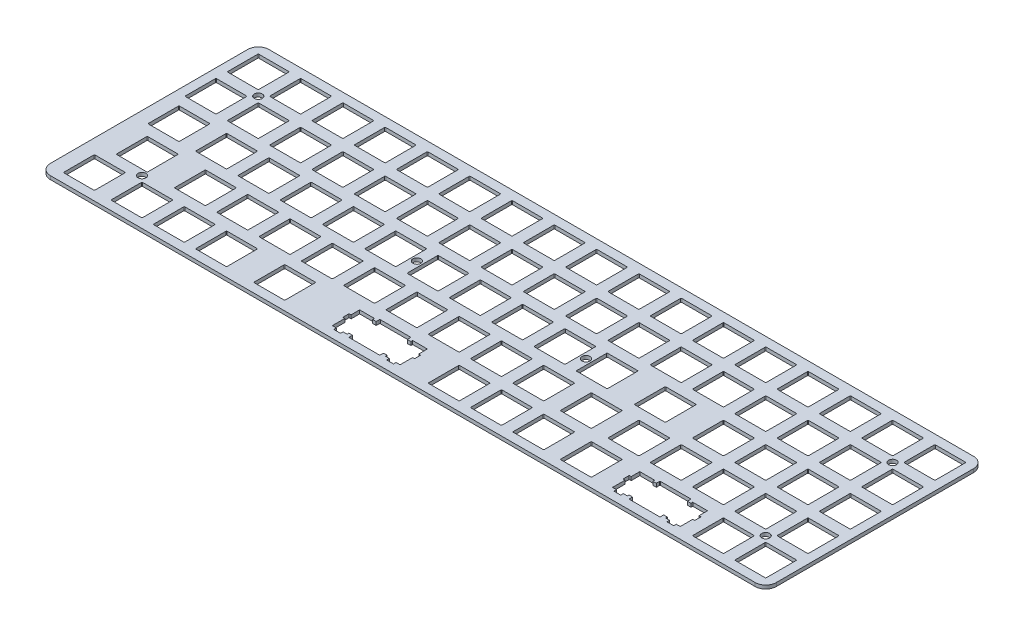
from build123d import *

# Parameters (mm, degrees)
SKETCH2_R           = 1.784477
SKETCH2_W           = 13.9954
SKETCH2_H           = 13.9954
BOSS_EXTRUDE1_DEPTH = 0.79375
CUT_EXTRUDE1_DEPTH  = 171.765125154
FILLET1_R           = 0.3048


with BuildPart() as part:
    # Sketch2 → Boss-Extrude1 (new, symmetric)
    with BuildSketch(Plane(origin=(0, 0, 0), x_dir=(1, 0, 0), z_dir=(0, 1, 0))):
        with BuildLine():
            Line((158.75, -49.2125), (-158.75, -49.2125))
            ThreePointArc((-158.75, -49.2125), (-162.117596045, -47.817596045), (-163.5125, -44.45))
            Line((-163.5125, -44.45), (-163.5125, 44.45))
            ThreePointArc((-163.5125, 44.45), (-162.117596045, 47.817596045), (-158.75, 49.2125))
            Line((-158.75, 49.2125), (158.75, 49.2125))
            ThreePointArc((158.75, 49.2125), (162.117596045, 47.817596045), (163.5125, 44.45))
            Line((163.5125, 44.45), (163.5125, -44.45))
            ThreePointArc((163.5125, -44.45), (162.117596045, -47.817596045), (158.75, -49.2125))
        make_face()
        with Locations((-142.875, 28.575)):
            Circle(SKETCH2_R, mode=Mode.SUBTRACT)
        with Locations((-138.1125, -28.575)):
            Circle(SKETCH2_R, mode=Mode.SUBTRACT)
        with Locations((142.875, 28.575)):
            Circle(SKETCH2_R, mode=Mode.SUBTRACT)
        with Locations((142.875, -28.575)):
            Circle(SKETCH2_R, mode=Mode.SUBTRACT)
        with Locations((-42.8625, 0)):
            Circle(SKETCH2_R, mode=Mode.SUBTRACT)
        with Locations((33.3375, 0)):
            Circle(SKETCH2_R, mode=Mode.SUBTRACT)
        with BuildLine():
            Line((-145.7071, 45.0977), (-159.0929, 45.0977))
            ThreePointArc((-159.0929, 45.0977), (-159.308426147, 45.008426147), (-159.3977, 44.7929))
            Line((-159.3977, 44.7929), (-159.3977, 31.4071))
            ThreePointArc((-159.3977, 31.4071), (-159.308426147, 31.191573853), (-159.0929, 31.1023))
            Line((-159.0929, 31.1023), (-145.7071, 31.1023))
            ThreePointArc((-145.7071, 31.1023), (-145.491573853, 31.191573853), (-145.4023, 31.4071))
            Line((-145.4023, 31.4071), (-145.4023, 44.7929))
            ThreePointArc((-145.4023, 44.7929), (-145.491573853, 45.008426147), (-145.7071, 45.0977))
        make_face(mode=Mode.SUBTRACT)
        with BuildLine():
            Line((-126.6571, 45.0977), (-140.0429, 45.0977))
            ThreePointArc((-140.0429, 45.0977), (-140.258426147, 45.008426147), (-140.3477, 44.7929))
            Line((-140.3477, 44.7929), (-140.3477, 31.4071))
            ThreePointArc((-140.3477, 31.4071), (-140.258426147, 31.191573853), (-140.0429, 31.1023))
            Line((-140.0429, 31.1023), (-126.6571, 31.1023))
            ThreePointArc((-126.6571, 31.1023), (-126.441573853, 31.191573853), (-126.3523, 31.4071))
            Line((-126.3523, 31.4071), (-126.3523, 44.7929))
            ThreePointArc((-126.3523, 44.7929), (-126.441573853, 45.008426147), (-126.6571, 45.0977))
        make_face(mode=Mode.SUBTRACT)
        with BuildLine():
            Line((-107.6071, 45.0977), (-120.9929, 45.0977))
            ThreePointArc((-120.9929, 45.0977), (-121.208426147, 45.008426147), (-121.2977, 44.7929))
            Line((-121.2977, 44.7929), (-121.2977, 31.4071))
            ThreePointArc((-121.2977, 31.4071), (-121.208426147, 31.191573853), (-120.9929, 31.1023))
            Line((-120.9929, 31.1023), (-107.6071, 31.1023))
            ThreePointArc((-107.6071, 31.1023), (-107.391573853, 31.191573853), (-107.3023, 31.4071))
            Line((-107.3023, 31.4071), (-107.3023, 44.7929))
            ThreePointArc((-107.3023, 44.7929), (-107.391573853, 45.008426147), (-107.6071, 45.0977))
        make_face(mode=Mode.SUBTRACT)
        with BuildLine():
            Line((-88.5571, 45.0977), (-101.9429, 45.0977))
            ThreePointArc((-101.9429, 45.0977), (-102.158426147, 45.008426147), (-102.2477, 44.7929))
            Line((-102.2477, 44.7929), (-102.2477, 31.4071))
            ThreePointArc((-102.2477, 31.4071), (-102.158426147, 31.191573853), (-101.9429, 31.1023))
            Line((-101.9429, 31.1023), (-88.5571, 31.1023))
            ThreePointArc((-88.5571, 31.1023), (-88.341573853, 31.191573853), (-88.2523, 31.4071))
            Line((-88.2523, 31.4071), (-88.2523, 44.7929))
            ThreePointArc((-88.2523, 44.7929), (-88.341573853, 45.008426147), (-88.5571, 45.0977))
        make_face(mode=Mode.SUBTRACT)
        with BuildLine():
            Line((-69.5071, 45.0977), (-82.8929, 45.0977))
            ThreePointArc((-82.8929, 45.0977), (-83.108426147, 45.008426147), (-83.1977, 44.7929))
            Line((-83.1977, 44.7929), (-83.1977, 31.4071))
            ThreePointArc((-83.1977, 31.4071), (-83.108426147, 31.191573853), (-82.8929, 31.1023))
            Line((-82.8929, 31.1023), (-69.5071, 31.1023))
            ThreePointArc((-69.5071, 31.1023), (-69.291573853, 31.191573853), (-69.2023, 31.4071))
            Line((-69.2023, 31.4071), (-69.2023, 44.7929))
            ThreePointArc((-69.2023, 44.7929), (-69.291573853, 45.008426147), (-69.5071, 45.0977))
        make_face(mode=Mode.SUBTRACT)
        with BuildLine():
            Line((-50.4571, 45.0977), (-63.8429, 45.0977))
            ThreePointArc((-63.8429, 45.0977), (-64.058426147, 45.008426147), (-64.1477, 44.7929))
            Line((-64.1477, 44.7929), (-64.1477, 31.4071))
            ThreePointArc((-64.1477, 31.4071), (-64.058426147, 31.191573853), (-63.8429, 31.1023))
            Line((-63.8429, 31.1023), (-50.4571, 31.1023))
            ThreePointArc((-50.4571, 31.1023), (-50.241573853, 31.191573853), (-50.1523, 31.4071))
            Line((-50.1523, 31.4071), (-50.1523, 44.7929))
            ThreePointArc((-50.1523, 44.7929), (-50.241573853, 45.008426147), (-50.4571, 45.0977))
        make_face(mode=Mode.SUBTRACT)
        with BuildLine():
            Line((-31.4071, 45.0977), (-44.7929, 45.0977))
            ThreePointArc((-44.7929, 45.0977), (-45.008426147, 45.008426147), (-45.0977, 44.7929))
            Line((-45.0977, 44.7929), (-45.0977, 31.4071))
            ThreePointArc((-45.0977, 31.4071), (-45.008426147, 31.191573853), (-44.7929, 31.1023))
            Line((-44.7929, 31.1023), (-31.4071, 31.1023))
            ThreePointArc((-31.4071, 31.1023), (-31.191573853, 31.191573853), (-31.1023, 31.4071))
            Line((-31.1023, 31.4071), (-31.1023, 44.7929))
            ThreePointArc((-31.1023, 44.7929), (-31.191573853, 45.008426147), (-31.4071, 45.0977))
        make_face(mode=Mode.SUBTRACT)
        with BuildLine():
            Line((-12.3571, 45.0977), (-25.7429, 45.0977))
            ThreePointArc((-25.7429, 45.0977), (-25.958426147, 45.008426147), (-26.0477, 44.7929))
            Line((-26.0477, 44.7929), (-26.0477, 31.4071))
            ThreePointArc((-26.0477, 31.4071), (-25.958426147, 31.191573853), (-25.7429, 31.1023))
            Line((-25.7429, 31.1023), (-12.3571, 31.1023))
            ThreePointArc((-12.3571, 31.1023), (-12.141573853, 31.191573853), (-12.0523, 31.4071))
            Line((-12.0523, 31.4071), (-12.0523, 44.7929))
            ThreePointArc((-12.0523, 44.7929), (-12.141573853, 45.008426147), (-12.3571, 45.0977))
        make_face(mode=Mode.SUBTRACT)
        with BuildLine():
            Line((6.6929, 45.0977), (-6.6929, 45.0977))
            ThreePointArc((-6.6929, 45.0977), (-6.908426147, 45.008426147), (-6.9977, 44.7929))
            Line((-6.9977, 44.7929), (-6.9977, 31.4071))
            ThreePointArc((-6.9977, 31.4071), (-6.908426147, 31.191573853), (-6.6929, 31.1023))
            Line((-6.6929, 31.1023), (6.6929, 31.1023))
            ThreePointArc((6.6929, 31.1023), (6.908426147, 31.191573853), (6.9977, 31.4071))
            Line((6.9977, 31.4071), (6.9977, 44.7929))
            ThreePointArc((6.9977, 44.7929), (6.908426147, 45.008426147), (6.6929, 45.0977))
        make_face(mode=Mode.SUBTRACT)
        with BuildLine():
            Line((25.7429, 45.0977), (12.3571, 45.0977))
            ThreePointArc((12.3571, 45.0977), (12.141573853, 45.008426147), (12.0523, 44.7929))
            Line((12.0523, 44.7929), (12.0523, 31.4071))
            ThreePointArc((12.0523, 31.4071), (12.141573853, 31.191573853), (12.3571, 31.1023))
            Line((12.3571, 31.1023), (25.7429, 31.1023))
            ThreePointArc((25.7429, 31.1023), (25.958426147, 31.191573853), (26.0477, 31.4071))
            Line((26.0477, 31.4071), (26.0477, 44.7929))
            ThreePointArc((26.0477, 44.7929), (25.958426147, 45.008426147), (25.7429, 45.0977))
        make_face(mode=Mode.SUBTRACT)
        with BuildLine():
            Line((44.7929, 45.0977), (31.4071, 45.0977))
            ThreePointArc((31.4071, 45.0977), (31.191573853, 45.008426147), (31.1023, 44.7929))
            Line((31.1023, 44.7929), (31.1023, 31.4071))
            ThreePointArc((31.1023, 31.4071), (31.191573853, 31.191573853), (31.4071, 31.1023))
            Line((31.4071, 31.1023), (44.7929, 31.1023))
            ThreePointArc((44.7929, 31.1023), (45.008426147, 31.191573853), (45.0977, 31.4071))
            Line((45.0977, 31.4071), (45.0977, 44.7929))
            ThreePointArc((45.0977, 44.7929), (45.008426147, 45.008426147), (44.7929, 45.0977))
        make_face(mode=Mode.SUBTRACT)
        with BuildLine():
            Line((63.8429, 45.0977), (50.4571, 45.0977))
            ThreePointArc((50.4571, 45.0977), (50.241573853, 45.008426147), (50.1523, 44.7929))
            Line((50.1523, 44.7929), (50.1523, 31.4071))
            ThreePointArc((50.1523, 31.4071), (50.241573853, 31.191573853), (50.4571, 31.1023))
            Line((50.4571, 31.1023), (63.8429, 31.1023))
            ThreePointArc((63.8429, 31.1023), (64.058426147, 31.191573853), (64.1477, 31.4071))
            Line((64.1477, 31.4071), (64.1477, 44.7929))
            ThreePointArc((64.1477, 44.7929), (64.058426147, 45.008426147), (63.8429, 45.0977))
        make_face(mode=Mode.SUBTRACT)
        with BuildLine():
            Line((82.8929, 45.0977), (69.5071, 45.0977))
            ThreePointArc((69.5071, 45.0977), (69.291573853, 45.008426147), (69.2023, 44.7929))
            Line((69.2023, 44.7929), (69.2023, 31.4071))
            ThreePointArc((69.2023, 31.4071), (69.291573853, 31.191573853), (69.5071, 31.1023))
            Line((69.5071, 31.1023), (82.8929, 31.1023))
            ThreePointArc((82.8929, 31.1023), (83.108426147, 31.191573853), (83.1977, 31.4071))
            Line((83.1977, 31.4071), (83.1977, 44.7929))
            ThreePointArc((83.1977, 44.7929), (83.108426147, 45.008426147), (82.8929, 45.0977))
        make_face(mode=Mode.SUBTRACT)
        with BuildLine():
            Line((101.9429, 45.0977), (88.5571, 45.0977))
            ThreePointArc((88.5571, 45.0977), (88.341573853, 45.008426147), (88.2523, 44.7929))
            Line((88.2523, 44.7929), (88.2523, 31.4071))
            ThreePointArc((88.2523, 31.4071), (88.341573853, 31.191573853), (88.5571, 31.1023))
            Line((88.5571, 31.1023), (101.9429, 31.1023))
            ThreePointArc((101.9429, 31.1023), (102.158426147, 31.191573853), (102.2477, 31.4071))
            Line((102.2477, 31.4071), (102.2477, 44.7929))
            ThreePointArc((102.2477, 44.7929), (102.158426147, 45.008426147), (101.9429, 45.0977))
        make_face(mode=Mode.SUBTRACT)
        with BuildLine():
            Line((120.9929, 45.0977), (107.6071, 45.0977))
            ThreePointArc((107.6071, 45.0977), (107.391573853, 45.008426147), (107.3023, 44.7929))
            Line((107.3023, 44.7929), (107.3023, 31.4071))
            ThreePointArc((107.3023, 31.4071), (107.391573853, 31.191573853), (107.6071, 31.1023))
            Line((107.6071, 31.1023), (120.9929, 31.1023))
            ThreePointArc((120.9929, 31.1023), (121.208426147, 31.191573853), (121.2977, 31.4071))
            Line((121.2977, 31.4071), (121.2977, 44.7929))
            ThreePointArc((121.2977, 44.7929), (121.208426147, 45.008426147), (120.9929, 45.0977))
        make_face(mode=Mode.SUBTRACT)
        with BuildLine():
            Line((140.0429, 45.0977), (126.6571, 45.0977))
            ThreePointArc((126.6571, 45.0977), (126.441573853, 45.008426147), (126.3523, 44.7929))
            Line((126.3523, 44.7929), (126.3523, 31.4071))
            ThreePointArc((126.3523, 31.4071), (126.441573853, 31.191573853), (126.6571, 31.1023))
            Line((126.6571, 31.1023), (140.0429, 31.1023))
            ThreePointArc((140.0429, 31.1023), (140.258426147, 31.191573853), (140.3477, 31.4071))
            Line((140.3477, 31.4071), (140.3477, 44.7929))
            ThreePointArc((140.3477, 44.7929), (140.258426147, 45.008426147), (140.0429, 45.0977))
        make_face(mode=Mode.SUBTRACT)
        with BuildLine():
            Line((159.0929, 45.0977), (145.7071, 45.0977))
            ThreePointArc((145.7071, 45.0977), (145.491573853, 45.008426147), (145.4023, 44.7929))
            Line((145.4023, 44.7929), (145.4023, 31.4071))
            ThreePointArc((145.4023, 31.4071), (145.491573853, 31.191573853), (145.7071, 31.1023))
            Line((145.7071, 31.1023), (159.0929, 31.1023))
            ThreePointArc((159.0929, 31.1023), (159.308426147, 31.191573853), (159.3977, 31.4071))
            Line((159.3977, 31.4071), (159.3977, 44.7929))
            ThreePointArc((159.3977, 44.7929), (159.308426147, 45.008426147), (159.0929, 45.0977))
        make_face(mode=Mode.SUBTRACT)
        with BuildLine():
            Line((-126.6571, 26.0477), (-140.0429, 26.0477))
            ThreePointArc((-140.0429, 26.0477), (-140.258426147, 25.958426147), (-140.3477, 25.7429))
            Line((-140.3477, 25.7429), (-140.3477, 12.3571))
            ThreePointArc((-140.3477, 12.3571), (-140.258426147, 12.141573853), (-140.0429, 12.0523))
            Line((-140.0429, 12.0523), (-126.6571, 12.0523))
            ThreePointArc((-126.6571, 12.0523), (-126.441573853, 12.141573853), (-126.3523, 12.3571))
            Line((-126.3523, 12.3571), (-126.3523, 25.7429))
            ThreePointArc((-126.3523, 25.7429), (-126.441573853, 25.958426147), (-126.6571, 26.0477))
        make_face(mode=Mode.SUBTRACT)
        with BuildLine():
            Line((-107.6071, 26.0477), (-120.9929, 26.0477))
            ThreePointArc((-120.9929, 26.0477), (-121.208426147, 25.958426147), (-121.2977, 25.7429))
            Line((-121.2977, 25.7429), (-121.2977, 12.3571))
            ThreePointArc((-121.2977, 12.3571), (-121.208426147, 12.141573853), (-120.9929, 12.0523))
            Line((-120.9929, 12.0523), (-107.6071, 12.0523))
            ThreePointArc((-107.6071, 12.0523), (-107.391573853, 12.141573853), (-107.3023, 12.3571))
            Line((-107.3023, 12.3571), (-107.3023, 25.7429))
            ThreePointArc((-107.3023, 25.7429), (-107.391573853, 25.958426147), (-107.6071, 26.0477))
        make_face(mode=Mode.SUBTRACT)
        with BuildLine():
            Line((-88.5571, 26.0477), (-101.9429, 26.0477))
            ThreePointArc((-101.9429, 26.0477), (-102.158426147, 25.958426147), (-102.2477, 25.7429))
            Line((-102.2477, 25.7429), (-102.2477, 12.3571))
            ThreePointArc((-102.2477, 12.3571), (-102.158426147, 12.141573853), (-101.9429, 12.0523))
            Line((-101.9429, 12.0523), (-88.5571, 12.0523))
            ThreePointArc((-88.5571, 12.0523), (-88.341573853, 12.141573853), (-88.2523, 12.3571))
            Line((-88.2523, 12.3571), (-88.2523, 25.7429))
            ThreePointArc((-88.2523, 25.7429), (-88.341573853, 25.958426147), (-88.5571, 26.0477))
        make_face(mode=Mode.SUBTRACT)
        with BuildLine():
            Line((-69.5071, 26.0477), (-82.8929, 26.0477))
            ThreePointArc((-82.8929, 26.0477), (-83.108426147, 25.958426147), (-83.1977, 25.7429))
            Line((-83.1977, 25.7429), (-83.1977, 12.3571))
            ThreePointArc((-83.1977, 12.3571), (-83.108426147, 12.141573853), (-82.8929, 12.0523))
            Line((-82.8929, 12.0523), (-69.5071, 12.0523))
            ThreePointArc((-69.5071, 12.0523), (-69.291573853, 12.141573853), (-69.2023, 12.3571))
            Line((-69.2023, 12.3571), (-69.2023, 25.7429))
            ThreePointArc((-69.2023, 25.7429), (-69.291573853, 25.958426147), (-69.5071, 26.0477))
        make_face(mode=Mode.SUBTRACT)
        with BuildLine():
            Line((-50.4571, 26.0477), (-63.8429, 26.0477))
            ThreePointArc((-63.8429, 26.0477), (-64.058426147, 25.958426147), (-64.1477, 25.7429))
            Line((-64.1477, 25.7429), (-64.1477, 12.3571))
            ThreePointArc((-64.1477, 12.3571), (-64.058426147, 12.141573853), (-63.8429, 12.0523))
            Line((-63.8429, 12.0523), (-50.4571, 12.0523))
            ThreePointArc((-50.4571, 12.0523), (-50.241573853, 12.141573853), (-50.1523, 12.3571))
            Line((-50.1523, 12.3571), (-50.1523, 25.7429))
            ThreePointArc((-50.1523, 25.7429), (-50.241573853, 25.958426147), (-50.4571, 26.0477))
        make_face(mode=Mode.SUBTRACT)
        with BuildLine():
            Line((-31.4071, 26.0477), (-44.7929, 26.0477))
            ThreePointArc((-44.7929, 26.0477), (-45.008426147, 25.958426147), (-45.0977, 25.7429))
            Line((-45.0977, 25.7429), (-45.0977, 12.3571))
            ThreePointArc((-45.0977, 12.3571), (-45.008426147, 12.141573853), (-44.7929, 12.0523))
            Line((-44.7929, 12.0523), (-31.4071, 12.0523))
            ThreePointArc((-31.4071, 12.0523), (-31.191573853, 12.141573853), (-31.1023, 12.3571))
            Line((-31.1023, 12.3571), (-31.1023, 25.7429))
            ThreePointArc((-31.1023, 25.7429), (-31.191573853, 25.958426147), (-31.4071, 26.0477))
        make_face(mode=Mode.SUBTRACT)
        with BuildLine():
            Line((-12.3571, 26.0477), (-25.7429, 26.0477))
            ThreePointArc((-25.7429, 26.0477), (-25.958426147, 25.958426147), (-26.0477, 25.7429))
            Line((-26.0477, 25.7429), (-26.0477, 12.3571))
            ThreePointArc((-26.0477, 12.3571), (-25.958426147, 12.141573853), (-25.7429, 12.0523))
            Line((-25.7429, 12.0523), (-12.3571, 12.0523))
            ThreePointArc((-12.3571, 12.0523), (-12.141573853, 12.141573853), (-12.0523, 12.3571))
            Line((-12.0523, 12.3571), (-12.0523, 25.7429))
            ThreePointArc((-12.0523, 25.7429), (-12.141573853, 25.958426147), (-12.3571, 26.0477))
        make_face(mode=Mode.SUBTRACT)
        with BuildLine():
            Line((6.6929, 26.0477), (-6.6929, 26.0477))
            ThreePointArc((-6.6929, 26.0477), (-6.908426147, 25.958426147), (-6.9977, 25.7429))
            Line((-6.9977, 25.7429), (-6.9977, 12.3571))
            ThreePointArc((-6.9977, 12.3571), (-6.908426147, 12.141573853), (-6.6929, 12.0523))
            Line((-6.6929, 12.0523), (6.6929, 12.0523))
            ThreePointArc((6.6929, 12.0523), (6.908426147, 12.141573853), (6.9977, 12.3571))
            Line((6.9977, 12.3571), (6.9977, 25.7429))
            ThreePointArc((6.9977, 25.7429), (6.908426147, 25.958426147), (6.6929, 26.0477))
        make_face(mode=Mode.SUBTRACT)
        with BuildLine():
            Line((25.7429, 26.0477), (12.3571, 26.0477))
            ThreePointArc((12.3571, 26.0477), (12.141573853, 25.958426147), (12.0523, 25.7429))
            Line((12.0523, 25.7429), (12.0523, 12.3571))
            ThreePointArc((12.0523, 12.3571), (12.141573853, 12.141573853), (12.3571, 12.0523))
            Line((12.3571, 12.0523), (25.7429, 12.0523))
            ThreePointArc((25.7429, 12.0523), (25.958426147, 12.141573853), (26.0477, 12.3571))
            Line((26.0477, 12.3571), (26.0477, 25.7429))
            ThreePointArc((26.0477, 25.7429), (25.958426147, 25.958426147), (25.7429, 26.0477))
        make_face(mode=Mode.SUBTRACT)
        with BuildLine():
            Line((44.7929, 26.0477), (31.4071, 26.0477))
            ThreePointArc((31.4071, 26.0477), (31.191573853, 25.958426147), (31.1023, 25.7429))
            Line((31.1023, 25.7429), (31.1023, 12.3571))
            ThreePointArc((31.1023, 12.3571), (31.191573853, 12.141573853), (31.4071, 12.0523))
            Line((31.4071, 12.0523), (44.7929, 12.0523))
            ThreePointArc((44.7929, 12.0523), (45.008426147, 12.141573853), (45.0977, 12.3571))
            Line((45.0977, 12.3571), (45.0977, 25.7429))
            ThreePointArc((45.0977, 25.7429), (45.008426147, 25.958426147), (44.7929, 26.0477))
        make_face(mode=Mode.SUBTRACT)
        with BuildLine():
            Line((63.8429, 26.0477), (50.4571, 26.0477))
            ThreePointArc((50.4571, 26.0477), (50.241573853, 25.958426147), (50.1523, 25.7429))
            Line((50.1523, 25.7429), (50.1523, 12.3571))
            ThreePointArc((50.1523, 12.3571), (50.241573853, 12.141573853), (50.4571, 12.0523))
            Line((50.4571, 12.0523), (63.8429, 12.0523))
            ThreePointArc((63.8429, 12.0523), (64.058426147, 12.141573853), (64.1477, 12.3571))
            Line((64.1477, 12.3571), (64.1477, 25.7429))
            ThreePointArc((64.1477, 25.7429), (64.058426147, 25.958426147), (63.8429, 26.0477))
        make_face(mode=Mode.SUBTRACT)
        with BuildLine():
            Line((82.8929, 26.0477), (69.5071, 26.0477))
            ThreePointArc((69.5071, 26.0477), (69.291573853, 25.958426147), (69.2023, 25.7429))
            Line((69.2023, 25.7429), (69.2023, 12.3571))
            ThreePointArc((69.2023, 12.3571), (69.291573853, 12.141573853), (69.5071, 12.0523))
            Line((69.5071, 12.0523), (82.8929, 12.0523))
            ThreePointArc((82.8929, 12.0523), (83.108426147, 12.141573853), (83.1977, 12.3571))
            Line((83.1977, 12.3571), (83.1977, 25.7429))
            ThreePointArc((83.1977, 25.7429), (83.108426147, 25.958426147), (82.8929, 26.0477))
        make_face(mode=Mode.SUBTRACT)
        with BuildLine():
            Line((101.9429, 26.0477), (88.5571, 26.0477))
            ThreePointArc((88.5571, 26.0477), (88.341573853, 25.958426147), (88.2523, 25.7429))
            Line((88.2523, 25.7429), (88.2523, 12.3571))
            ThreePointArc((88.2523, 12.3571), (88.341573853, 12.141573853), (88.5571, 12.0523))
            Line((88.5571, 12.0523), (101.9429, 12.0523))
            ThreePointArc((101.9429, 12.0523), (102.158426147, 12.141573853), (102.2477, 12.3571))
            Line((102.2477, 12.3571), (102.2477, 25.7429))
            ThreePointArc((102.2477, 25.7429), (102.158426147, 25.958426147), (101.9429, 26.0477))
        make_face(mode=Mode.SUBTRACT)
        with BuildLine():
            Line((120.9929, 26.0477), (107.6071, 26.0477))
            ThreePointArc((107.6071, 26.0477), (107.391573853, 25.958426147), (107.3023, 25.7429))
            Line((107.3023, 25.7429), (107.3023, 12.3571))
            ThreePointArc((107.3023, 12.3571), (107.391573853, 12.141573853), (107.6071, 12.0523))
            Line((107.6071, 12.0523), (120.9929, 12.0523))
            ThreePointArc((120.9929, 12.0523), (121.208426147, 12.141573853), (121.2977, 12.3571))
            Line((121.2977, 12.3571), (121.2977, 25.7429))
            ThreePointArc((121.2977, 25.7429), (121.208426147, 25.958426147), (120.9929, 26.0477))
        make_face(mode=Mode.SUBTRACT)
        with BuildLine():
            Line((140.0429, 26.0477), (126.6571, 26.0477))
            ThreePointArc((126.6571, 26.0477), (126.441573853, 25.958426147), (126.3523, 25.7429))
            Line((126.3523, 25.7429), (126.3523, 12.3571))
            ThreePointArc((126.3523, 12.3571), (126.441573853, 12.141573853), (126.6571, 12.0523))
            Line((126.6571, 12.0523), (140.0429, 12.0523))
            ThreePointArc((140.0429, 12.0523), (140.258426147, 12.141573853), (140.3477, 12.3571))
            Line((140.3477, 12.3571), (140.3477, 25.7429))
            ThreePointArc((140.3477, 25.7429), (140.258426147, 25.958426147), (140.0429, 26.0477))
        make_face(mode=Mode.SUBTRACT)
        with BuildLine():
            Line((159.0929, 26.0477), (145.7071, 26.0477))
            ThreePointArc((145.7071, 26.0477), (145.491573853, 25.958426147), (145.4023, 25.7429))
            Line((145.4023, 25.7429), (145.4023, 12.3571))
            ThreePointArc((145.4023, 12.3571), (145.491573853, 12.141573853), (145.7071, 12.0523))
            Line((145.7071, 12.0523), (159.0929, 12.0523))
            ThreePointArc((159.0929, 12.0523), (159.308426147, 12.141573853), (159.3977, 12.3571))
            Line((159.3977, 12.3571), (159.3977, 25.7429))
            ThreePointArc((159.3977, 25.7429), (159.308426147, 25.958426147), (159.0929, 26.0477))
        make_face(mode=Mode.SUBTRACT)
        with BuildLine():
            Line((-145.7071, 26.0477), (-159.0929, 26.0477))
            ThreePointArc((-159.0929, 26.0477), (-159.308426147, 25.958426147), (-159.3977, 25.7429))
            Line((-159.3977, 25.7429), (-159.3977, 12.3571))
            ThreePointArc((-159.3977, 12.3571), (-159.308426147, 12.141573853), (-159.0929, 12.0523))
            Line((-159.0929, 12.0523), (-145.7071, 12.0523))
            ThreePointArc((-145.7071, 12.0523), (-145.491573853, 12.141573853), (-145.4023, 12.3571))
            Line((-145.4023, 12.3571), (-145.4023, 25.7429))
            ThreePointArc((-145.4023, 25.7429), (-145.491573853, 25.958426147), (-145.7071, 26.0477))
        make_face(mode=Mode.SUBTRACT)
        with Locations((-150.01875, 0)):
            Rectangle(SKETCH2_W, SKETCH2_H, mode=Mode.SUBTRACT)
        with Locations((-145.25625, -19.05)):
            Rectangle(SKETCH2_W, SKETCH2_H, mode=Mode.SUBTRACT)
        with Locations((-150.01875, -38.1)):
            Rectangle(SKETCH2_W, SKETCH2_H, mode=Mode.SUBTRACT)
        with Locations((-128.5875, 0)):
            Rectangle(SKETCH2_W, SKETCH2_H, mode=Mode.SUBTRACT)
        with Locations((-119.0625, -19.05)):
            Rectangle(SKETCH2_W, SKETCH2_H, mode=Mode.SUBTRACT)
        with Locations((-128.5875, -38.1)):
            Rectangle(SKETCH2_W, SKETCH2_H, mode=Mode.SUBTRACT)
        with Locations((-109.5375, 0)):
            Rectangle(SKETCH2_W, SKETCH2_H, mode=Mode.SUBTRACT)
        with Locations((-90.4875, 0)):
            Rectangle(SKETCH2_W, SKETCH2_H, mode=Mode.SUBTRACT)
        with Locations((-71.4375, 0)):
            Rectangle(SKETCH2_W, SKETCH2_H, mode=Mode.SUBTRACT)
        with Locations((-52.3875, 0)):
            Rectangle(SKETCH2_W, SKETCH2_H, mode=Mode.SUBTRACT)
        with Locations((-33.3375, 0)):
            Rectangle(SKETCH2_W, SKETCH2_H, mode=Mode.SUBTRACT)
        with Locations((-14.2875, 0)):
            Rectangle(SKETCH2_W, SKETCH2_H, mode=Mode.SUBTRACT)
        with Locations((4.7625, 0)):
            Rectangle(SKETCH2_W, SKETCH2_H, mode=Mode.SUBTRACT)
        with Locations((23.8125, 0)):
            Rectangle(SKETCH2_W, SKETCH2_H, mode=Mode.SUBTRACT)
        with Locations((42.8625, 0)):
            Rectangle(SKETCH2_W, SKETCH2_H, mode=Mode.SUBTRACT)
        with Locations((-100.0125, -19.05)):
            Rectangle(SKETCH2_W, SKETCH2_H, mode=Mode.SUBTRACT)
        with Locations((-80.9625, -19.05)):
            Rectangle(SKETCH2_W, SKETCH2_H, mode=Mode.SUBTRACT)
        with Locations((-61.9125, -19.05)):
            Rectangle(SKETCH2_W, SKETCH2_H, mode=Mode.SUBTRACT)
        with Locations((-42.8625, -19.05)):
            Rectangle(SKETCH2_W, SKETCH2_H, mode=Mode.SUBTRACT)
        with Locations((-23.8125, -19.05)):
            Rectangle(SKETCH2_W, SKETCH2_H, mode=Mode.SUBTRACT)
        with Locations((-4.7625, -19.05)):
            Rectangle(SKETCH2_W, SKETCH2_H, mode=Mode.SUBTRACT)
        with Locations((14.2875, -19.05)):
            Rectangle(SKETCH2_W, SKETCH2_H, mode=Mode.SUBTRACT)
        with Locations((33.3375, -19.05)):
            Rectangle(SKETCH2_W, SKETCH2_H, mode=Mode.SUBTRACT)
        with Locations((-109.5375, -38.1)):
            Rectangle(SKETCH2_W, SKETCH2_H, mode=Mode.SUBTRACT)
        with Locations((-90.4875, -38.1)):
            Rectangle(SKETCH2_W, SKETCH2_H, mode=Mode.SUBTRACT)
        with BuildLine():
            Line((101.9429, -6.9977), (88.5571, -6.9977))
            ThreePointArc((88.5571, -6.9977), (88.341573853, -6.908426147), (88.2523, -6.6929))
            Line((88.2523, -6.6929), (88.2523, 6.6929))
            ThreePointArc((88.2523, 6.6929), (88.341573853, 6.908426147), (88.5571, 6.9977))
            Line((88.5571, 6.9977), (101.9429, 6.9977))
            ThreePointArc((101.9429, 6.9977), (102.158426147, 6.908426147), (102.2477, 6.6929))
            Line((102.2477, 6.6929), (102.2477, -6.6929))
            ThreePointArc((102.2477, -6.6929), (102.158426147, -6.908426147), (101.9429, -6.9977))
        make_face(mode=Mode.SUBTRACT)
        with Locations((14.2875, -38.1)):
            Rectangle(SKETCH2_W, SKETCH2_H, mode=Mode.SUBTRACT)
        with Locations((33.3375, -38.1)):
            Rectangle(SKETCH2_W, SKETCH2_H, mode=Mode.SUBTRACT)
        with Locations((52.3875, -38.1)):
            Rectangle(SKETCH2_W, SKETCH2_H, mode=Mode.SUBTRACT)
        with Locations((73.81875, -38.1)):
            Rectangle(SKETCH2_W, SKETCH2_H, mode=Mode.SUBTRACT)
        with BuildLine():
            Line((120.9929, -6.9977), (107.6071, -6.9977))
            ThreePointArc((107.6071, -6.9977), (107.391573853, -6.908426147), (107.3023, -6.6929))
            Line((107.3023, -6.6929), (107.3023, 6.6929))
            ThreePointArc((107.3023, 6.6929), (107.391573853, 6.908426147), (107.6071, 6.9977))
            Line((107.6071, 6.9977), (120.9929, 6.9977))
            ThreePointArc((120.9929, 6.9977), (121.208426147, 6.908426147), (121.2977, 6.6929))
            Line((121.2977, 6.6929), (121.2977, -6.6929))
            ThreePointArc((121.2977, -6.6929), (121.208426147, -6.908426147), (120.9929, -6.9977))
        make_face(mode=Mode.SUBTRACT)
        with BuildLine():
            Line((140.0429, 6.9977), (126.6571, 6.9977))
            ThreePointArc((126.6571, 6.9977), (126.441573853, 6.908426147), (126.3523, 6.6929))
            Line((126.3523, 6.6929), (126.3523, -6.6929))
            ThreePointArc((126.3523, -6.6929), (126.441573853, -6.908426147), (126.6571, -6.9977))
            Line((126.6571, -6.9977), (140.0429, -6.9977))
            ThreePointArc((140.0429, -6.9977), (140.258426147, -6.908426147), (140.3477, -6.6929))
            Line((140.3477, -6.6929), (140.3477, 6.6929))
            ThreePointArc((140.3477, 6.6929), (140.258426147, 6.908426147), (140.0429, 6.9977))
        make_face(mode=Mode.SUBTRACT)
        with BuildLine():
            Line((159.3977, 6.6929), (159.3977, -6.6929))
            ThreePointArc((159.3977, -6.6929), (159.308426147, -6.908426147), (159.0929, -6.9977))
            Line((159.0929, -6.9977), (145.7071, -6.9977))
            ThreePointArc((145.7071, -6.9977), (145.491573853, -6.908426147), (145.4023, -6.6929))
            Line((145.4023, -6.6929), (145.4023, 6.6929))
            ThreePointArc((145.4023, 6.6929), (145.491573853, 6.908426147), (145.7071, 6.9977))
            Line((145.7071, 6.9977), (159.0929, 6.9977))
            ThreePointArc((159.0929, 6.9977), (159.308426147, 6.908426147), (159.3977, 6.6929))
        make_face(mode=Mode.SUBTRACT)
        with BuildLine():
            Line((101.9429, -26.0477), (88.5571, -26.0477))
            ThreePointArc((88.5571, -26.0477), (88.341573853, -25.958426147), (88.2523, -25.7429))
            Line((88.2523, -25.7429), (88.2523, -12.3571))
            ThreePointArc((88.2523, -12.3571), (88.341573853, -12.141573853), (88.5571, -12.0523))
            Line((88.5571, -12.0523), (101.9429, -12.0523))
            ThreePointArc((101.9429, -12.0523), (102.158426147, -12.141573853), (102.2477, -12.3571))
            Line((102.2477, -12.3571), (102.2477, -25.7429))
            ThreePointArc((102.2477, -25.7429), (102.158426147, -25.958426147), (101.9429, -26.0477))
        make_face(mode=Mode.SUBTRACT)
        with BuildLine():
            Line((120.9929, -26.0477), (107.6071, -26.0477))
            ThreePointArc((107.6071, -26.0477), (107.391573853, -25.958426147), (107.3023, -25.7429))
            Line((107.3023, -25.7429), (107.3023, -12.3571))
            ThreePointArc((107.3023, -12.3571), (107.391573853, -12.141573853), (107.6071, -12.0523))
            Line((107.6071, -12.0523), (120.9929, -12.0523))
            ThreePointArc((120.9929, -12.0523), (121.208426147, -12.141573853), (121.2977, -12.3571))
            Line((121.2977, -12.3571), (121.2977, -25.7429))
            ThreePointArc((121.2977, -25.7429), (121.208426147, -25.958426147), (120.9929, -26.0477))
        make_face(mode=Mode.SUBTRACT)
        with BuildLine():
            Line((140.0429, -12.0523), (126.6571, -12.0523))
            ThreePointArc((126.6571, -12.0523), (126.441573853, -12.141573853), (126.3523, -12.3571))
            Line((126.3523, -12.3571), (126.3523, -25.7429))
            ThreePointArc((126.3523, -25.7429), (126.441573853, -25.958426147), (126.6571, -26.0477))
            Line((126.6571, -26.0477), (140.0429, -26.0477))
            ThreePointArc((140.0429, -26.0477), (140.258426147, -25.958426147), (140.3477, -25.7429))
            Line((140.3477, -25.7429), (140.3477, -12.3571))
            ThreePointArc((140.3477, -12.3571), (140.258426147, -12.141573853), (140.0429, -12.0523))
        make_face(mode=Mode.SUBTRACT)
        with BuildLine():
            Line((159.3977, -12.3571), (159.3977, -25.7429))
            ThreePointArc((159.3977, -25.7429), (159.308426147, -25.958426147), (159.0929, -26.0477))
            Line((159.0929, -26.0477), (145.7071, -26.0477))
            ThreePointArc((145.7071, -26.0477), (145.491573853, -25.958426147), (145.4023, -25.7429))
            Line((145.4023, -25.7429), (145.4023, -12.3571))
            ThreePointArc((145.4023, -12.3571), (145.491573853, -12.141573853), (145.7071, -12.0523))
            Line((145.7071, -12.0523), (159.0929, -12.0523))
            ThreePointArc((159.0929, -12.0523), (159.308426147, -12.141573853), (159.3977, -12.3571))
        make_face(mode=Mode.SUBTRACT)
        with Locations((152.4, -38.1)):
            Rectangle(SKETCH2_W, SKETCH2_H, mode=Mode.SUBTRACT)
        with Locations((133.35, -38.1)):
            Rectangle(SKETCH2_W, SKETCH2_H, mode=Mode.SUBTRACT)
        with Locations((76.2, -19.05)):
            Rectangle(SKETCH2_W, SKETCH2_H, mode=Mode.SUBTRACT)
        with Locations((54.76875, -19.05)):
            Rectangle(SKETCH2_W, SKETCH2_H, mode=Mode.SUBTRACT)
        with Locations((69.05625, 0)):
            Rectangle(SKETCH2_W, SKETCH2_H, mode=Mode.SUBTRACT)
        with Locations((-64.29375, -38.1)):
            Rectangle(SKETCH2_W, SKETCH2_H, mode=Mode.SUBTRACT)
        with Locations((-21.43125, -38.1)):
            Rectangle(SKETCH2_W, SKETCH2_H, mode=Mode.SUBTRACT)
        with Locations((104.775, -38.1)):
            Rectangle(SKETCH2_W, SKETCH2_H, mode=Mode.SUBTRACT)
    extrude(amount=BOSS_EXTRUDE1_DEPTH, both=True)

    # Sketch4 → Cut-Extrude1 (cut, through all)
    with BuildSketch(Plane(origin=(0, 0.79375, 0), x_dir=(1, 0, 0), z_dir=(0, 1, 0))):
        Polygon((-36.69665, -44.2341), (-34.89325, -44.2341), (-34.89325, -45.4025), (-31.84525, -45.4025), (-31.84525, -44.2341), (-30.04185, -44.2341), (-30.04185, -43.4467), (-28.42895, -43.4467), (-28.42895, -32.7533), (-30.04185, -32.7533), (-30.04185, -31.9405), (-36.69665, -31.9405), (-36.69665, -35.814), (-37.58565, -35.814), (-37.58565, -38.608), (-36.69665, -38.608), align=None)
        Polygon((-6.16585, -35.814), (-6.16585, -31.9405), (-12.82065, -31.9405), (-12.82065, -32.7533), (-14.43355, -32.7533), (-14.43355, -43.4467), (-12.82065, -43.4467), (-12.82065, -44.2341), (-11.01725, -44.2341), (-11.01725, -45.4025), (-7.96925, -45.4025), (-7.96925, -44.2341), (-6.16585, -44.2341), (-6.16585, -38.608), (-5.27685, -38.608), (-5.27685, -35.814), align=None)
        Polygon((115.189, -44.2341), (113.3856, -44.2341), (113.3856, -43.4467), (111.7727, -43.4467), (111.7727, -32.7533), (113.3856, -32.7533), (113.3856, -31.9405), (120.0404, -31.9405), (120.0404, -35.814), (120.9294, -35.814), (120.9294, -38.608), (120.0404, -38.608), (120.0404, -44.2341), (118.237, -44.2341), (118.237, -45.4025), (115.189, -45.4025), align=None)
        Polygon((96.1644, -44.2341), (96.1644, -43.4467), (97.7773, -43.4467), (97.7773, -32.7533), (96.1644, -32.7533), (96.1644, -31.9405), (89.5096, -31.9405), (89.5096, -35.814), (88.6206, -35.814), (88.6206, -38.608), (89.5096, -38.608), (89.5096, -44.2341), (91.313, -44.2341), (91.313, -45.4025), (94.361, -45.4025), (94.361, -44.2341), align=None)
    extrude(amount=-CUT_EXTRUDE1_DEPTH, mode=Mode.SUBTRACT)

    # Fillet1
    fillet1_edges = [part.edges().sort_by_distance(p)[0] for p in [
        (47.77105, 0, 12.0523),
        (47.77105, 0, 26.0477),
        (61.76645, 0, 26.0477),
        (61.76645, 0, 12.0523),
        (69.2023, 0, 12.0523),
        (69.2023, 0, 26.0477),
        (83.1977, 0, 26.0477),
        (83.1977, 0, 12.0523),
        (126.3523, 0, 31.1023),
        (126.3523, 0, 45.0977),
        (140.3477, 0, 45.0977),
        (140.3477, 0, 31.1023),
        (145.4023, 0, 31.1023),
        (145.4023, 0, 45.0977),
        (159.3977, 0, 45.0977),
        (159.3977, 0, 31.1023),
        (66.82105, 0, 31.1023),
        (66.82105, 0, 45.0977),
        (80.81645, 0, 45.0977),
        (80.81645, 0, 31.1023),
        (45.3898, 0, 31.1023),
        (45.3898, 0, 45.0977),
        (59.3852, 0, 45.0977),
        (59.3852, 0, 31.1023),
        (26.3398, 0, 31.1023),
        (26.3398, 0, 45.0977),
        (40.3352, 0, 45.0977),
        (40.3352, 0, 31.1023),
        (7.2898, 0, 31.1023),
        (7.2898, 0, 45.0977),
        (21.2852, 0, 45.0977),
        (21.2852, 0, 31.1023),
        (-97.4852, 0, 31.1023),
        (-97.4852, 0, 45.0977),
        (-83.4898, 0, 45.0977),
        (-83.4898, 0, 31.1023),
        (40.3352, 0, 26.0477),
        (40.3352, 0, 12.0523),
        (26.3398, 0, 12.0523),
        (26.3398, 0, 26.0477),
        (21.2852, 0, 26.0477),
        (21.2852, 0, 12.0523),
        (7.2898, 0, 12.0523),
        (7.2898, 0, 26.0477),
        (2.2352, 0, 26.0477),
        (2.2352, 0, 12.0523),
        (-11.7602, 0, 12.0523),
        (-11.7602, 0, 26.0477),
        (-16.8148, 0, 26.0477),
        (-16.8148, 0, 12.0523),
        (-30.8102, 0, 12.0523),
        (-30.8102, 0, 26.0477),
        (-35.8648, 0, 26.0477),
        (-35.8648, 0, 12.0523),
        (-49.8602, 0, 12.0523),
        (-49.8602, 0, 26.0477),
        (-54.9148, 0, 26.0477),
        (-54.9148, 0, 12.0523),
        (-68.9102, 0, 12.0523),
        (-68.9102, 0, 26.0477),
        (-73.9648, 0, 26.0477),
        (-73.9648, 0, 12.0523),
        (-87.9602, 0, 12.0523),
        (-87.9602, 0, 26.0477),
        (49.8602, 0, 6.9977),
        (49.8602, 0, -6.9977),
        (35.8648, 0, -6.9977),
        (35.8648, 0, 6.9977),
        (30.8102, 0, 6.9977),
        (30.8102, 0, -6.9977),
        (16.8148, 0, -6.9977),
        (16.8148, 0, 6.9977),
        (11.7602, 0, 6.9977),
        (11.7602, 0, -6.9977),
        (-2.2352, 0, -6.9977),
        (-2.2352, 0, 6.9977),
        (-7.2898, 0, 6.9977),
        (-7.2898, 0, -6.9977),
        (-21.2852, 0, -6.9977),
        (-21.2852, 0, 6.9977),
        (-26.3398, 0, 6.9977),
        (-26.3398, 0, -6.9977),
        (-40.3352, 0, -6.9977),
        (-40.3352, 0, 6.9977),
        (-45.3898, 0, 6.9977),
        (-45.3898, 0, -6.9977),
        (-59.3852, 0, -6.9977),
        (-59.3852, 0, 6.9977),
        (-64.4398, 0, 6.9977),
        (-64.4398, 0, -6.9977),
        (-78.4352, 0, -6.9977),
        (-78.4352, 0, 6.9977),
        (-83.4898, 0, 6.9977),
        (-83.4898, 0, -6.9977),
        (-97.4852, 0, -6.9977),
        (-97.4852, 0, 6.9977),
        (-102.5398, 0, 6.9977),
        (-102.5398, 0, -6.9977),
        (-116.5352, 0, -6.9977),
        (-116.5352, 0, 6.9977),
        (-93.0148, 0, 26.0477),
        (-93.0148, 0, 12.0523),
        (-107.0102, 0, 12.0523),
        (-107.0102, 0, 26.0477),
        (-116.5352, 0, 31.1023),
        (-116.5352, 0, 45.0977),
        (-102.5398, 0, 45.0977),
        (-102.5398, 0, 31.1023),
        (-135.5852, 0, 31.1023),
        (-135.5852, 0, 45.0977),
        (-121.5898, 0, 45.0977),
        (-121.5898, 0, 31.1023),
        (-112.0648, 0, 26.0477),
        (-112.0648, 0, 12.0523),
        (-126.0602, 0, 12.0523),
        (-126.0602, 0, 26.0477),
        (-121.5898, 0, 6.9977),
        (-135.5852, 0, -6.9977),
        (-135.5852, 0, 6.9977),
        (-143.02105, 0, 45.0977),
        (-143.02105, 0, 31.1023),
        (-157.01645, 0, 31.1023),
        (-157.01645, 0, 45.0977),
        (-138.25855, 0, 26.0477),
        (-138.25855, 0, 12.0523),
        (-152.25395, 0, 12.0523),
        (-152.25395, 0, 26.0477),
        (-157.01645, 0, -6.9977),
        (-157.01645, 0, 6.9977),
        (-143.02105, 0, 6.9977),
        (-121.5898, 0, -6.9977),
        (-143.02105, 0, -6.9977),
        (76.05395, 0, 6.9977),
        (62.05855, 0, 6.9977),
        (62.05855, 0, -6.9977),
        (76.05395, 0, -6.9977),
        (97.7773, 0, 31.1023),
        (97.7773, 0, 45.0977),
        (111.7727, 0, 31.1023),
        (111.7727, 0, 45.0977),
        (-14.43355, 0, 45.0977),
        (-57.29605, 0, 45.0977),
        (-71.29145, 0, 45.0977),
        (-28.42895, 0, 45.0977),
        (-28.42895, 0, 31.1023),
        (-71.29145, 0, 31.1023),
        (-14.43355, 0, 31.1023),
        (-57.29605, 0, 31.1023),
    ]]
    fillet(fillet1_edges, radius=FILLET1_R)


solid = part.part
